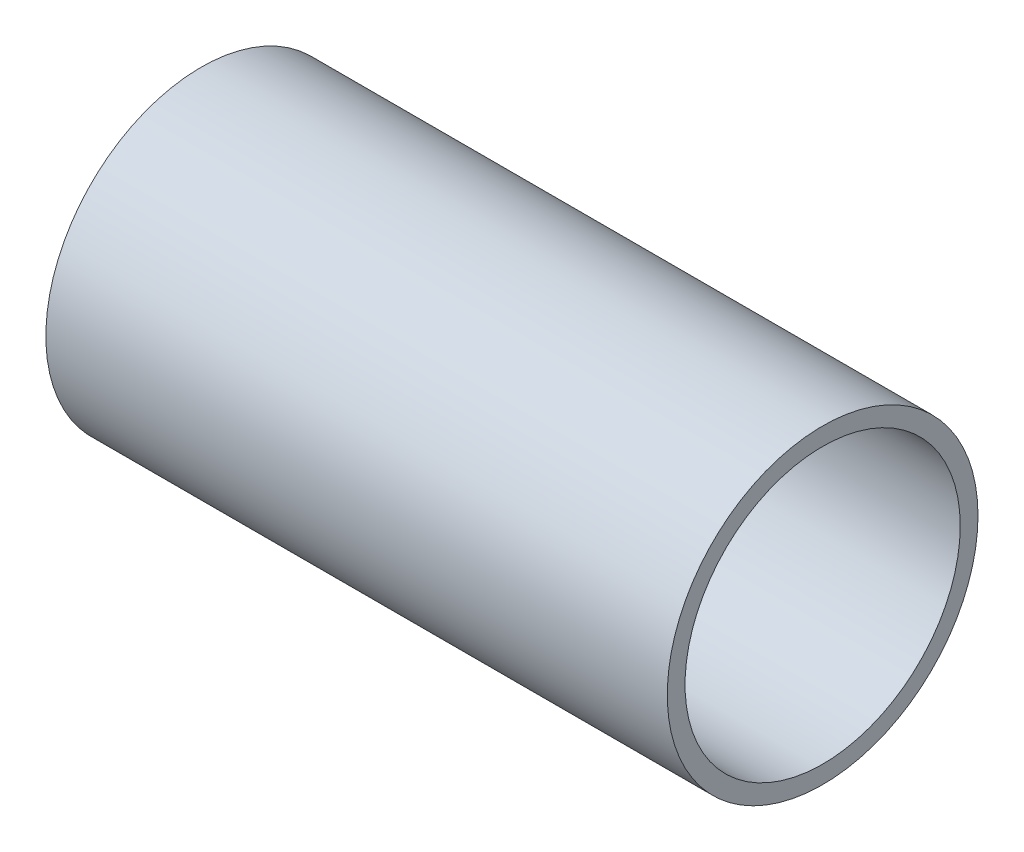
from build123d import *

# Parameters (mm, degrees)
SKETCH_1_R      = 17.5
SKETCH_1_R_2    = 15.5
EXTRUDE_1_DEPTH = 70


with BuildPart() as part:
    # Эскиз1 → Бобышка-Вытянуть1 (new body)
    with BuildSketch(Plane(origin=(0, 0, 0), x_dir=(0, 0, -1), z_dir=(1, 0, 0))):
        Circle(SKETCH_1_R)
        Circle(SKETCH_1_R_2, mode=Mode.SUBTRACT)
    extrude(amount=EXTRUDE_1_DEPTH)


solid = part.part
